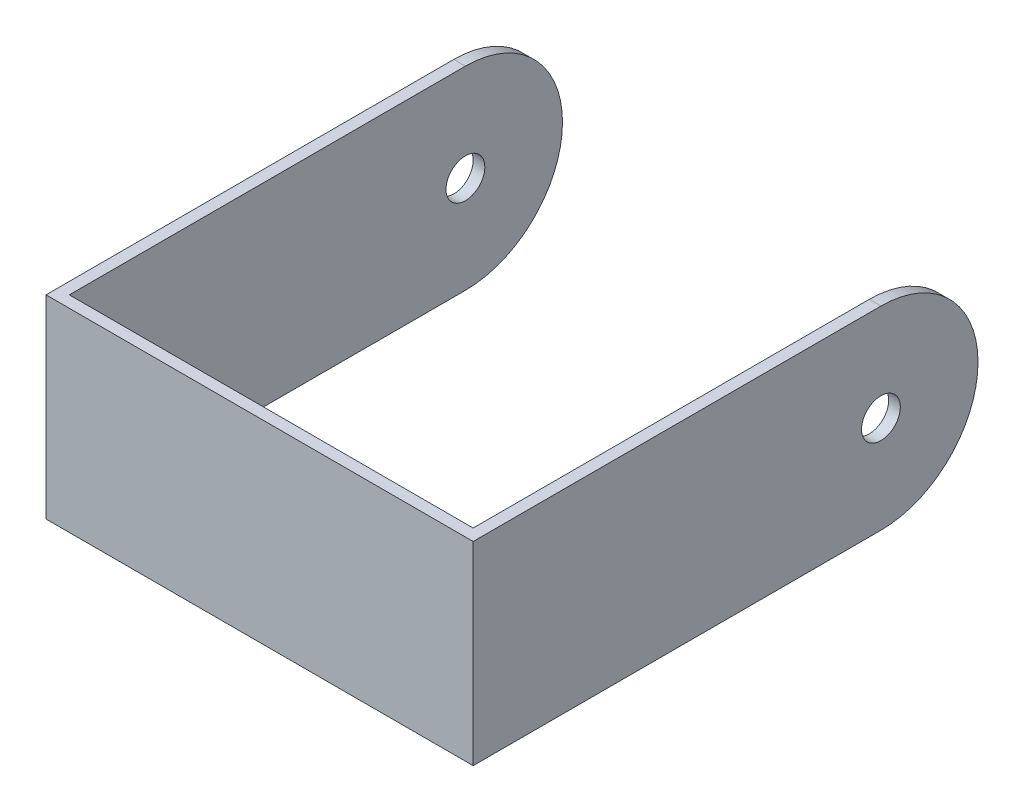
from build123d import *

# Parameters (mm, degrees)
BOSS_EXTRUDE1_DEPTH     = 12.5
FILLET1_R               = 12.5
CUT_EXTRUDE1_DEPTH      = 45.370598373
CUT_EXTRUDE1_DEPTH_BACK = 45.370598373
SKETCH2_R               = 2.5


with BuildPart() as part:
    # Sketch1 → Boss-Extrude1 (new, symmetric)
    with BuildSketch(Plane(origin=(0, 0, 0), x_dir=(1, 0, 0), z_dir=(0, 1, 0))):
        Polygon((26, -31), (26, 32.5), (27.5, 32.5), (27.5, -32.5), (-27.5, -32.5), (-27.5, 32.5), (-26, 32.5), (-26, -31), align=None)
    extrude(amount=BOSS_EXTRUDE1_DEPTH, both=True)

    # Fillet1
    fillet1_edges = [part.edges().sort_by_distance(p)[0] for p in [
        (-26.75, -12.5, -32.5),
        (-26.75, 12.5, -32.5),
        (26.75, -12.5, -32.5),
        (26.75, 12.5, -32.5),
    ]]
    fillet(fillet1_edges, radius=FILLET1_R - 0.0001)  # a hair under: the kernel refuses the full size

    # Sketch2 → Cut-Extrude1 (cut, two sides: drawn at the far end of the back side and taken through both)
    with BuildSketch(Plane(origin=(0, 0, 0), x_dir=(0, 0, -1), z_dir=(1, 0, 0)).offset(-CUT_EXTRUDE1_DEPTH_BACK)):
        with Locations((20, 0)):
            Circle(SKETCH2_R)
    extrude(amount=CUT_EXTRUDE1_DEPTH + CUT_EXTRUDE1_DEPTH_BACK, mode=Mode.SUBTRACT)


solid = part.part
